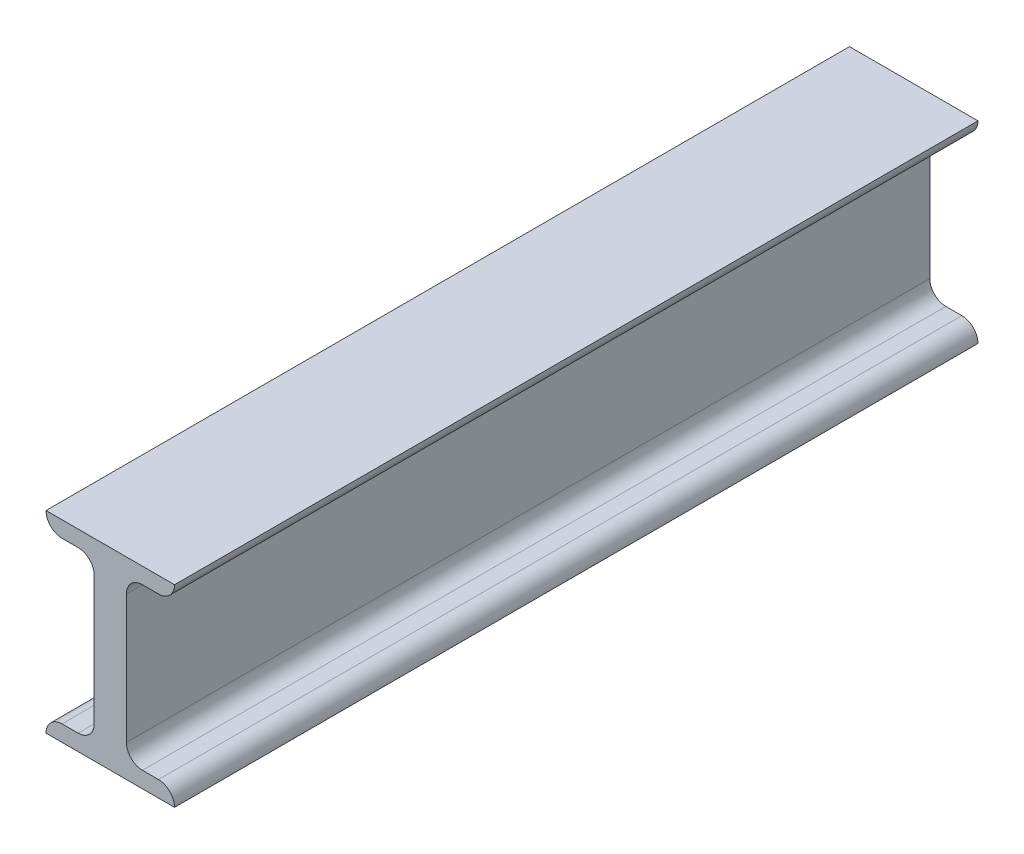
from build123d import *

# Parameters (mm, degrees)
DODANIE_WYCI_GNI_CIE1_DEPTH = 250
ZAOKR_GLENIE2_DEPTH         = 250
ZAOKR_GLENIE2_2_DEPTH       = 250


with BuildPart() as part:
    # Szkic1 → Dodanie-wyciągnięcie1 (new body)
    with BuildSketch(Plane.XY):
        Polygon((0, 0), (40, 0), (40, 5), (25, 5), (25, 55), (40, 55), (40, 60), (0, 60), (0, 55), (15, 55), (15, 5), (0, 5), align=None)
    extrude(amount=DODANIE_WYCI_GNI_CIE1_DEPTH)

    # Zaokrąglenie2: read off the stored shape, not the designer's step
    # Zaokrąglenie2 outline → Zaokrąglenie2 (cut)
    with BuildSketch(Plane.XY):
        with BuildLine():
            Line((40, 55), (40, 60))
            ThreePointArc((40, 60), (38.535533906, 56.464466094), (35, 55))
            Line((35, 55), (40, 55))
        make_face()
        with BuildLine():
            Line((40, 5), (35, 5))
            ThreePointArc((35, 5), (38.535533906, 3.535533906), (40, 0))
            Line((40, 0), (40, 5))
        make_face()
        with BuildLine():
            Line((0, 55), (5, 55))
            ThreePointArc((5, 55), (1.464466094, 56.464466094), (0, 60))
            Line((0, 60), (0, 55))
        make_face()
        with BuildLine():
            ThreePointArc((0, 0), (1.464466094, 3.535533906), (5, 5))
            Line((5, 5), (0, 5))
            Line((0, 5), (0, 0))
        make_face()
    extrude(amount=ZAOKR_GLENIE2_DEPTH, mode=Mode.SUBTRACT)

    # Zaokr_glenie2 2 outline → Zaokr_glenie2 2 (add)
    with BuildSketch(Plane.XY):
        with BuildLine():
            ThreePointArc((30, 5), (26.464466094, 6.464466094), (25, 10))
            Line((25, 10), (25, 5))
            Line((25, 5), (30, 5))
        make_face()
        with BuildLine():
            ThreePointArc((25, 50), (26.464466094, 53.535533906), (30, 55))
            Line((30, 55), (25, 55))
            Line((25, 55), (25, 50))
        make_face()
        with BuildLine():
            ThreePointArc((10, 55), (13.535533906, 53.535533906), (15, 50))
            Line((15, 50), (15, 55))
            Line((15, 55), (10, 55))
        make_face()
        with BuildLine():
            ThreePointArc((15, 10), (13.535533906, 6.464466094), (10, 5))
            Line((10, 5), (15, 5))
            Line((15, 5), (15, 10))
        make_face()
    extrude(amount=ZAOKR_GLENIE2_2_DEPTH)


solid = part.part
